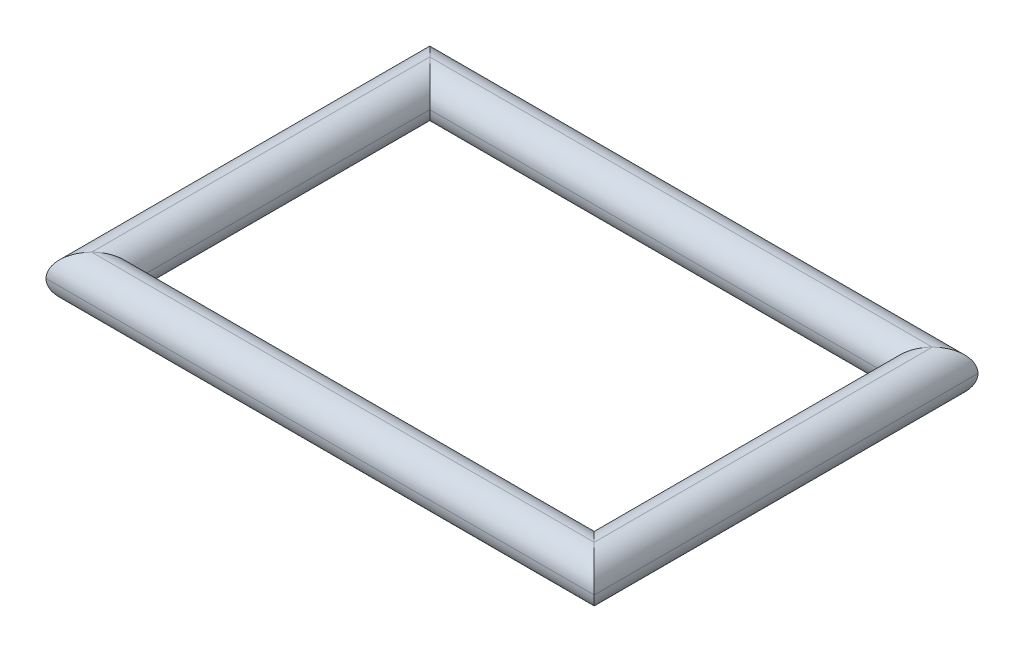
from build123d import *

# Parameters (mm, degrees)
SKETCH1_W           = 60
SKETCH1_H           = 42
BOSS_EXTRUDE1_DEPTH = 5
SKETCH2_W           = 50
SKETCH2_H           = 32
CUT_EXTRUDE1_DEPTH  = 5
FILLET1_R           = 2.5
FILLET2_R           = 2.5


with BuildPart() as part:
    # Sketch1 → Boss-Extrude1 (new body)
    with BuildSketch(Plane(origin=(0, 0, 0), x_dir=(1, 0, 0), z_dir=(0, 1, 0))):
        with Locations((-3.018867925, 4.471698113)):
            Rectangle(SKETCH1_W, SKETCH1_H)
    extrude(amount=BOSS_EXTRUDE1_DEPTH)

    # Sketch2 → Cut-Extrude1 (cut)
    with BuildSketch(Plane(origin=(0, 5, 0), x_dir=(1, 0, 0), z_dir=(0, 1, 0))):
        with Locations((-3.018867925, 4.471698113)):
            Rectangle(SKETCH2_W, SKETCH2_H)
    extrude(amount=-CUT_EXTRUDE1_DEPTH, mode=Mode.SUBTRACT)

    # Fillet1
    fillet1_edges = [part.edges().sort_by_distance(p)[0] for p in [
        (-3.018867925, 5, 16.528301887),
        (-33.018867925, 5, -4.471698113),
        (-28.018867925, 5, -4.471698113),
        (-3.018867925, 5, 11.528301887),
        (21.981132075, 5, -4.471698113),
        (-3.018867925, 5, -20.471698113),
        (-3.018867925, 5, -25.471698113),
        (26.981132075, 5, -4.471698113),
    ]]
    fillet(fillet1_edges, radius=FILLET1_R - 0.0001)  # a hair under: the kernel refuses the full size

    # Fillet2
    fillet2_edges = [part.edges().sort_by_distance(p)[0] for p in [
        (-33.018867925, 0, -4.471698113),
        (-3.018867925, 0, 16.528301887),
        (26.981132075, 0, -4.471698113),
        (-3.018867925, 0, -25.471698113),
        (-3.018867925, 0, -20.471698113),
        (21.981132075, 0, -4.471698113),
        (-3.018867925, 0, 11.528301887),
        (-28.018867925, 0, -4.471698113),
    ]]
    fillet(fillet2_edges, radius=FILLET2_R - 0.0001)  # a hair under: the kernel refuses the full size


solid = part.part
